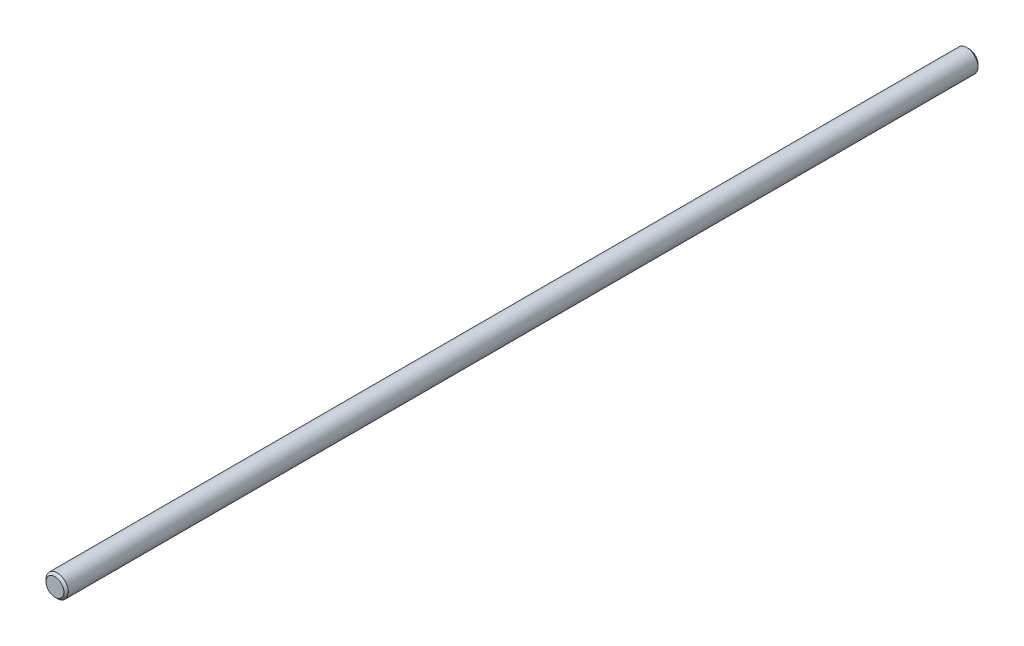
from build123d import *

# Parameters (mm, degrees)
SCHIZZO1_R                   = 5
ESTRUSIONE_ESTRUSIONE1_DEPTH = 410
SMUSSO1_SIZE                 = 1


with BuildPart() as part:
    # Schizzo1 → Estrusione-Estrusione1 (new body)
    with BuildSketch(Plane.XY):
        Circle(SCHIZZO1_R)
    extrude(amount=ESTRUSIONE_ESTRUSIONE1_DEPTH)

    # Smusso1
    smusso1_edges = [part.edges().sort_by_distance(p)[0] for p in [
        (-5, 0, 410),
        (-5, 0, 0),
    ]]
    chamfer(smusso1_edges, length=SMUSSO1_SIZE)


solid = part.part
